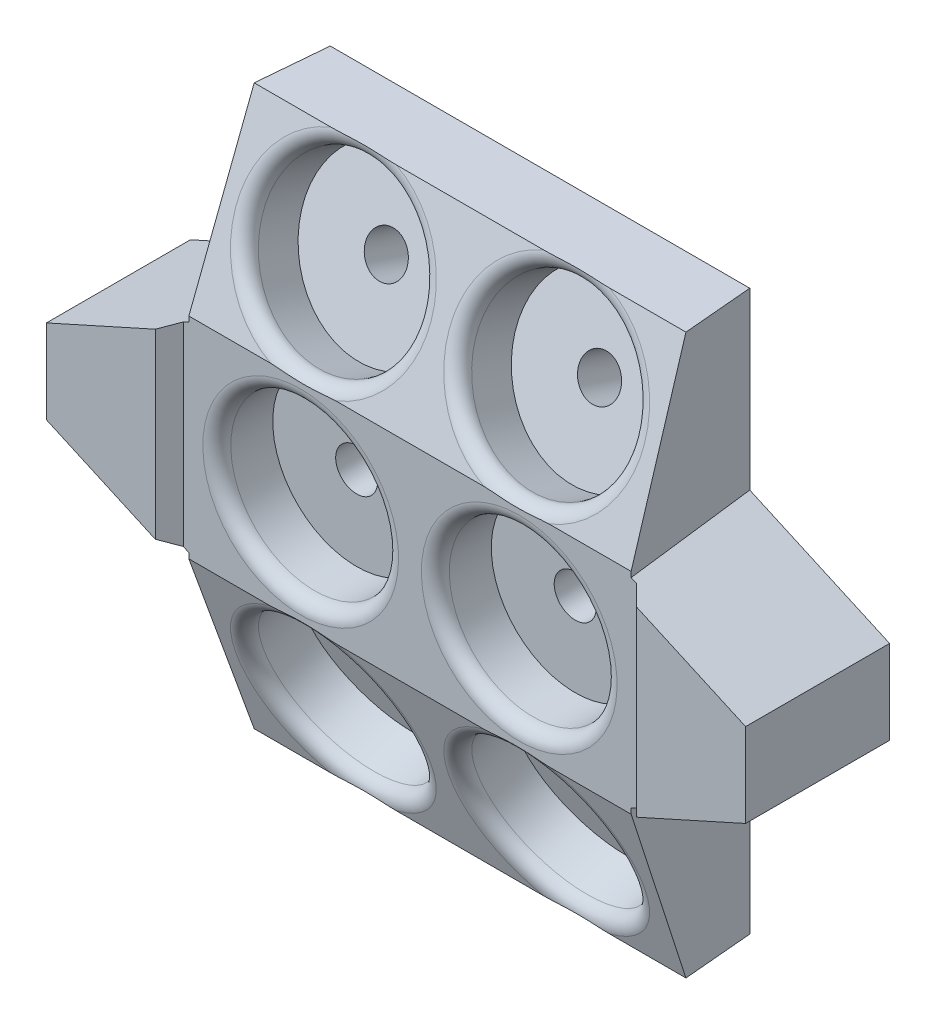
from build123d import *

# Parameters (mm, degrees)
BOSS_EXTRUDE1_DEPTH     = 40
CUT_EXTRUDE1_DEPTH      = 52.509791542
CUT_EXTRUDE1_DEPTH_BACK = 52.509791542
SKETCH5_R               = 6
CUT_EXTRUDE2_DEPTH      = 4
SKETCH7_R               = 6
CUT_EXTRUDE3_DEPTH      = 4
FILLET1_R               = 1
BOSS_EXTRUDE2_DEPTH     = 6
SKETCH10_R              = 2.1
CUT_EXTRUDE5_DEPTH      = 4
CUT_EXTRUDE6_REACH      = 58.816
SKETCH11_R              = 1.5
CUT_EXTRUDE7_REACH      = 59.386
SKETCH12_R              = 1.5
CUT_EXTRUDE8_REACH      = 57.054
SKETCH13_R              = 1.5
BOSS_EXTRUDE3_DEPTH     = 3.297499639
BOSS_EXTRUDE4_DEPTH     = 1
CHAMFER1_SIZE           = 1


# Some blends are built 0.0001 mm under size
with BuildPart() as part:
    # Sketch2 → Boss-Extrude1 (new body)
    with BuildSketch(Plane(origin=(0, 0, 0), x_dir=(1, 0, 0), z_dir=(0, 1, 0))):
        Polygon((0, 0), (30, 0), (30.874886635, -10), (-0.874886635, -10), align=None)
    extrude(amount=BOSS_EXTRUDE1_DEPTH)

    # Sketch3 → Cut-Extrude1 (cut, two sides: drawn at the far end of the back side and taken through both)
    with BuildSketch(Plane(origin=(0, 0, 0), x_dir=(0, 0, -1), z_dir=(1, 0, 0)).offset(-CUT_EXTRUDE1_DEPTH_BACK)):
        Polygon((-5, 0), (-9.297499639, 12.480845198), (-9.297499639, 27.519154802), (-5, 40), (-10, 40), (-10, 0), align=None)
    extrude(amount=CUT_EXTRUDE1_DEPTH + CUT_EXTRUDE1_DEPTH_BACK, mode=Mode.SUBTRACT)

    # Sketch5 → Cut-Extrude2 (cut)
    with BuildSketch(Plane(origin=(0, -1.539153688, 4.470026884), x_dir=(1, 0, 0), z_dir=(0, -0.32556815445715714, 0.9455185755993166))):
        with Locations(Location((7.374565432, 8.227840772, 0), (0, 0, 270))):
            Circle(SKETCH5_R)
        with Locations(Location((22.625434568, 8.227840772, 0), (0, 0, 270))):
            Circle(SKETCH5_R)
    cut_extrude2 = extrude(amount=-CUT_EXTRUDE2_DEPTH, mode=Mode.SUBTRACT)

    # Mirror3: Cut-Extrude2 across plane
    add(cut_extrude2.mirror(Plane.ZX.offset(20)), mode=Mode.SUBTRACT)

    # Sketch7 → Cut-Extrude3 (cut)
    with BuildSketch(Plane.XY.offset(9.297499639)):
        with Locations((7.186574182, 20)):
            Circle(SKETCH7_R)
        with Locations((22.813425818, 20)):
            Circle(SKETCH7_R)
    extrude(amount=-CUT_EXTRUDE3_DEPTH, mode=Mode.SUBTRACT)

    # Fillet1
    # the kernel refuses this fillet: 1 mm, written as the material it takes off along each edge
    with BuildSketch(Plane(origin=(7.374565432, 6.240422599, 7.148749819), x_dir=(0, -0.9455185755993166, -0.3255681544571572), z_dir=(-1, 0, 0))) as fillet1_piece_1:
        with BuildLine():
            CenterArc((6 + FILLET1_R, -FILLET1_R), FILLET1_R, 90, 90)
            Line((6, -FILLET1_R), (6, 0))
            Line((6, 0), (6 + FILLET1_R, 0))
        make_face()
    revolve(axis=Axis((7.374565432, 6.240422599, 7.148749819), (0, -0.32556815445715714, 0.9455185755993166)), mode=Mode.SUBTRACT)
    with BuildSketch(Plane(origin=(22.625434568, 6.240422599, 7.148749819), x_dir=(0, -0.9455185755993167, -0.3255681544571572), z_dir=(-1, 0, 0))) as fillet1_piece_2:
        with BuildLine():
            CenterArc((6 + FILLET1_R, -FILLET1_R), FILLET1_R, 90, 90)
            Line((6, -FILLET1_R), (6, 0))
            Line((6, 0), (6 + FILLET1_R, 0))
        make_face()
    revolve(axis=Axis((22.625434568, 6.240422599, 7.148749819), (0, -0.32556815445715714, 0.9455185755993166)), mode=Mode.SUBTRACT)
    with BuildSketch(Plane(origin=(7.374565432, 33.759577401, 7.148749819), x_dir=(0, 0.9455185755993166, -0.32556815445715714), z_dir=(-1, 0, 0))) as fillet1_piece_3:
        with BuildLine():
            CenterArc((6 + FILLET1_R, FILLET1_R), FILLET1_R, 180, 90)
            Line((6, FILLET1_R), (6, 0))
            Line((6, 0), (6 + FILLET1_R, 0))
        make_face()
    revolve(axis=Axis((7.374565432, 33.759577401, 7.148749819), (0, -0.3255681544571571, -0.9455185755993166)), mode=Mode.SUBTRACT)
    with BuildSketch(Plane(origin=(22.625434568, 33.759577401, 7.148749819), x_dir=(0, 0.9455185755993165, -0.3255681544571574), z_dir=(-1, 0, 0))) as fillet1_piece_4:
        with BuildLine():
            CenterArc((6 + FILLET1_R, FILLET1_R), FILLET1_R, 180, 90)
            Line((6, FILLET1_R), (6, 0))
            Line((6, 0), (6 + FILLET1_R, 0))
        make_face()
    revolve(axis=Axis((22.625434568, 33.759577401, 7.148749819), (0, -0.3255681544571571, -0.9455185755993166)), mode=Mode.SUBTRACT)
    with BuildSketch(Plane(origin=(7.186574182, 20, 9.297499639), x_dir=(1, 0, 0), z_dir=(0, -1, 0))) as fillet1_piece_5:
        with BuildLine():
            CenterArc((6 + FILLET1_R, -FILLET1_R), FILLET1_R, 90, 90)
            Line((6, -FILLET1_R), (6, 0))
            Line((6, 0), (6 + FILLET1_R, 0))
        make_face()
    revolve(axis=Axis((7.186574182, 20, 9.297499639), (0, 0, 1)), mode=Mode.SUBTRACT)
    with BuildSketch(Plane(origin=(22.813425818, 20, 9.297499639), x_dir=(1, 0, 0), z_dir=(0, -1, 0))) as fillet1_piece_6:
        with BuildLine():
            CenterArc((6 + FILLET1_R, -FILLET1_R), FILLET1_R, 90, 90)
            Line((6, -FILLET1_R), (6, 0))
            Line((6, 0), (6 + FILLET1_R, 0))
        make_face()
    revolve(axis=Axis((22.813425818, 20, 9.297499639), (0, 0, 1)), mode=Mode.SUBTRACT)

    # Sketch9 → Boss-Extrude2 (add)
    with BuildSketch(Plane(origin=(0, 0, 0), x_dir=(-1, 0, 0), z_dir=(0, 0, -1))):
        Polygon((-30, 12.5), (-40, 17), (-40, 23), (-30, 27.5), align=None)
        Polygon((0, 12.5), (0, 27.5), (10, 23), (10, 17), align=None)
    extrude(amount=-BOSS_EXTRUDE2_DEPTH)

    # Sketch10 → Cut-Extrude5 (cut)
    with BuildSketch(Plane(origin=(0, 0, 0), x_dir=(-1, 0, 0), z_dir=(0, 0, -1))):
        with Locations((-15, 37.5)):
            Circle(SKETCH10_R)
        with Locations((-15, 2.5)):
            Circle(SKETCH10_R)
        with Locations((-35, 20)):
            Circle(SKETCH10_R)
        with Locations((5, 20)):
            Circle(SKETCH10_R)
    extrude(amount=-CUT_EXTRUDE5_DEPTH, mode=Mode.SUBTRACT)

    # Sketch11 → Cut-Extrude6 (cut, up to next)
    with BuildSketch(Plane.XY.offset(5.297499639), mode=Mode.PRIVATE) as cut_extrude6_sk1:
        with Locations((7.186574182, 20)):
            Circle(SKETCH11_R)
    cut_extrude6_tool1 = extrude(cut_extrude6_sk1.sketch, amount=-CUT_EXTRUDE6_REACH, mode=Mode.PRIVATE) & part.part
    # Sketch11 → Cut-Extrude6 (cut, up to next)
    with BuildSketch(Plane.XY.offset(5.297499639), mode=Mode.PRIVATE) as cut_extrude6_sk2:
        with Locations((22.813425818, 20)):
            Circle(SKETCH11_R)
    cut_extrude6_tool2 = extrude(cut_extrude6_sk2.sketch, amount=-CUT_EXTRUDE6_REACH, mode=Mode.PRIVATE) & part.part
    add(cut_extrude6_tool1.solids().sort_by_distance((7.186574, 20, 5.2975))[0], mode=Mode.SUBTRACT)
    add(cut_extrude6_tool2.solids().sort_by_distance((22.813426, 20, 5.2975))[0], mode=Mode.SUBTRACT)

    # Cut-Extrude7: up to this plane
    cut_extrude7_end = Plane(origin=(0, 40, 0), z_dir=(0, 0, 1))
    # Sketch12 → Cut-Extrude7 (cut, up to the surface)
    with BuildSketch(Plane(origin=(0, -0.23688107, 0.687952582), x_dir=(1, 0, 0), z_dir=(0, -0.3255681544571572, 0.9455185755993167)), mode=Mode.PRIVATE) as cut_extrude7_sk1:
        with Locations(Location((7.374565432, 8.227840772, 0), (0, 0, 270))):
            Circle(SKETCH12_R)
    cut_extrude7_tool1 = split(extrude(cut_extrude7_sk1.sketch, amount=-CUT_EXTRUDE7_REACH, mode=Mode.PRIVATE), bisect_by=cut_extrude7_end, keep=Keep.BOTH, mode=Mode.PRIVATE)
    add(cut_extrude7_tool1.solids().sort_by_distance((7.374565, 7.542695, 3.366676))[0], mode=Mode.SUBTRACT)
    # Sketch12 → Cut-Extrude7 (cut, up to the surface)
    with BuildSketch(Plane(origin=(0, -0.23688107, 0.687952582), x_dir=(1, 0, 0), z_dir=(0, -0.3255681544571572, 0.9455185755993167)), mode=Mode.PRIVATE) as cut_extrude7_sk2:
        with Locations(Location((22.625434568, 8.227840772, 0), (0, 0, 270))):
            Circle(SKETCH12_R)
    cut_extrude7_tool2 = split(extrude(cut_extrude7_sk2.sketch, amount=-CUT_EXTRUDE7_REACH, mode=Mode.PRIVATE), bisect_by=cut_extrude7_end, keep=Keep.BOTH, mode=Mode.PRIVATE)
    add(cut_extrude7_tool2.solids().sort_by_distance((22.625435, 7.542695, 3.366676))[0], mode=Mode.SUBTRACT)

    # Cut-Extrude8: up to this plane
    cut_extrude8_end = Plane(origin=(0, 40, 0), z_dir=(0, 0, 1))
    # Sketch13 → Cut-Extrude8 (cut, up to the surface)
    with BuildSketch(Plane(origin=(0, 4.476665998, 13.001182088), x_dir=(1, 0, 0), z_dir=(0, 0.3255681544571572, 0.9455185755993167)), mode=Mode.PRIVATE) as cut_extrude8_sk1:
        with Locations(Location((22.625434568, 29.592902252, 0), (0, 0, 270))):
            Circle(SKETCH13_R)
    cut_extrude8_tool1 = split(extrude(cut_extrude8_sk1.sketch, amount=-CUT_EXTRUDE8_REACH, mode=Mode.PRIVATE), bisect_by=cut_extrude8_end, keep=Keep.BOTH, mode=Mode.PRIVATE)
    add(cut_extrude8_tool1.solids().sort_by_distance((22.625435, 32.457305, 3.366676))[0], mode=Mode.SUBTRACT)
    # Sketch13 → Cut-Extrude8 (cut, up to the surface)
    with BuildSketch(Plane(origin=(0, 4.476665998, 13.001182088), x_dir=(1, 0, 0), z_dir=(0, 0.3255681544571572, 0.9455185755993167)), mode=Mode.PRIVATE) as cut_extrude8_sk2:
        with Locations(Location((7.374565432, 29.592902252, 0), (0, 0, 270))):
            Circle(SKETCH13_R)
    cut_extrude8_tool2 = split(extrude(cut_extrude8_sk2.sketch, amount=-CUT_EXTRUDE8_REACH, mode=Mode.PRIVATE), bisect_by=cut_extrude8_end, keep=Keep.BOTH, mode=Mode.PRIVATE)
    add(cut_extrude8_tool2.solids().sort_by_distance((7.374565, 32.457305, 3.366676))[0], mode=Mode.SUBTRACT)

    # Sketch15 → Boss-Extrude3 (add)
    with BuildSketch(Plane.XY.offset(6)):
        Polygon((30.524931981, 27.263780608), (30.524931981, 12.736219392), (40, 17), (40, 23), align=None)
        Polygon((-0.524931981, 12.736219392), (-0.524931981, 27.263780608), (-10, 23), (-10, 17), align=None)
    extrude(amount=BOSS_EXTRUDE3_DEPTH)

    # Sketch17 → Boss-Extrude4 (add)
    with BuildSketch(Plane.XY.offset(9.297499639)):
        Polygon((31.213425818, 26.953958382), (31.213425818, 13.046041618), (40, 17), (40, 23), align=None)
        Polygon((-10, 17), (-1.213425818, 13.046041618), (-1.213425818, 26.953958382), (-10, 23), align=None)
    extrude(amount=BOSS_EXTRUDE4_DEPTH)

    # Chamfer1
    chamfer1_edges = [part.edges().sort_by_distance(p)[0] for p in [
        (31.213425818, 20, 10.297499639),
        (-1.213425818, 20, 10.297499639),
    ]]
    chamfer(chamfer1_edges, length=CHAMFER1_SIZE - 0.0001)  # a hair under: the kernel refuses the full size


solid = part.part
